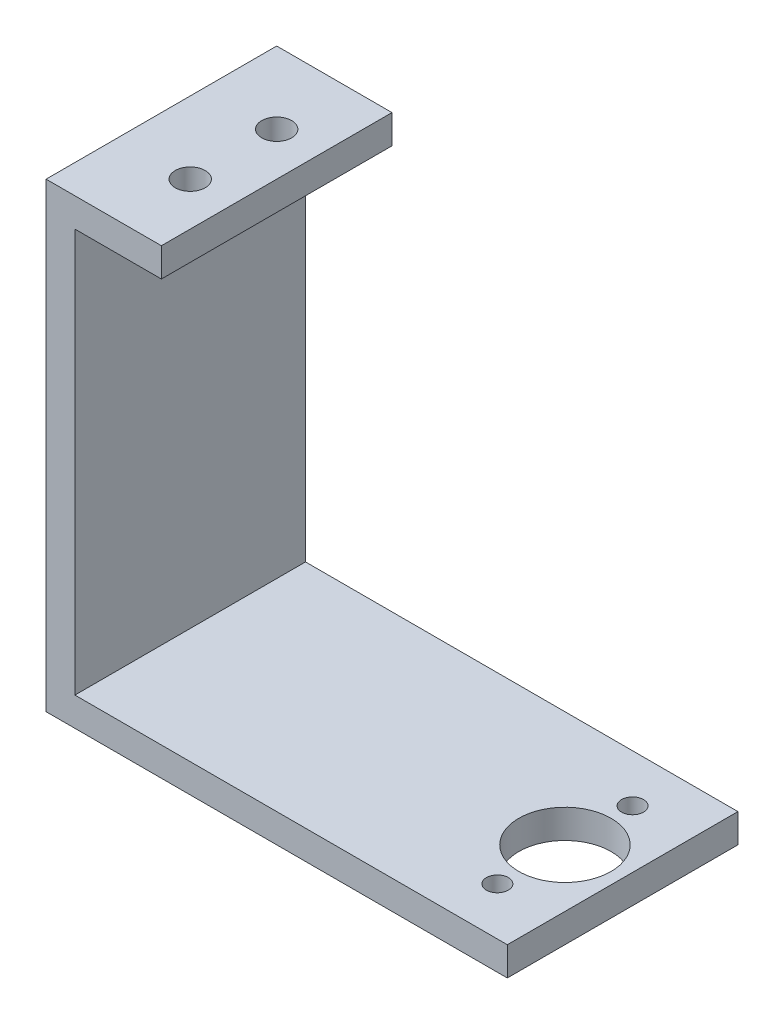
from build123d import *

# Parameters (mm, degrees)
BOSS_EXTRUDE1_DEPTH       = 25.4
M4X0_7_TAPPED_HOLE1_D     = 3.3
M4X0_7_TAPPED_HOLE1_DEPTH = 9.906
M4X0_7_TAPPED_HOLE1_TIP   = 0.991420021
CUT_EXTRUDE1_REACH        = 66.12
SKETCH7_R                 = 5.08
SKETCH7_R_2               = 1.2065


with BuildPart() as part:
    # Sketch1 → Boss-Extrude1 (new body)
    with BuildSketch(Plane.XY):
        Polygon((-17.059275079, 26.987213855), (-29.759275079, 26.987213855), (-29.759275079, -23.812786145), (21.040724921, -23.812786145), (21.040724921, -20.637786145), (-26.584275079, -20.637786145), (-26.584275079, 23.812213855), (-17.059275079, 23.812213855), align=None)
    extrude(amount=BOSS_EXTRUDE1_DEPTH)

    # M4x0.7 Tapped Hole1
    with Locations(Plane(origin=(0, 26.987213855, 0), x_dir=(1, 0, 0), z_dir=(0, 1, 0))):
        with Locations((-21.821775079, -7.9375), (-21.821775079, -17.4625)):
            Hole(M4X0_7_TAPPED_HOLE1_D / 2, depth=M4X0_7_TAPPED_HOLE1_DEPTH)
            with Locations((0, 0, -(M4X0_7_TAPPED_HOLE1_DEPTH + M4X0_7_TAPPED_HOLE1_TIP / 2))):  # 118° drill point
                Cone(0, M4X0_7_TAPPED_HOLE1_D / 2, M4X0_7_TAPPED_HOLE1_TIP, mode=Mode.SUBTRACT)

    # Sketch7 → Cut-Extrude1 (cut, up to next)
    with BuildSketch(Plane.XZ.offset(23.812786145), mode=Mode.PRIVATE) as cut_extrude1_sk1:
        with Locations((14.690724921, 12.7)):
            Circle(SKETCH7_R)
    cut_extrude1_tool1 = extrude(cut_extrude1_sk1.sketch, amount=-CUT_EXTRUDE1_REACH, mode=Mode.PRIVATE) & part.part
    # Sketch7 → Cut-Extrude1 (cut, up to next)
    with BuildSketch(Plane.XZ.offset(23.812786145), mode=Mode.PRIVATE) as cut_extrude1_sk2:
        with Locations((14.690724921, 5.2578)):
            Circle(SKETCH7_R_2)
    cut_extrude1_tool2 = extrude(cut_extrude1_sk2.sketch, amount=-CUT_EXTRUDE1_REACH, mode=Mode.PRIVATE) & part.part
    # Sketch7 → Cut-Extrude1 (cut, up to next)
    with BuildSketch(Plane.XZ.offset(23.812786145), mode=Mode.PRIVATE) as cut_extrude1_sk3:
        with Locations((14.690724921, 20.1422)):
            Circle(SKETCH7_R_2)
    cut_extrude1_tool3 = extrude(cut_extrude1_sk3.sketch, amount=-CUT_EXTRUDE1_REACH, mode=Mode.PRIVATE) & part.part
    add(cut_extrude1_tool1.solids().sort_by_distance((14.690725, -23.812786, 12.7))[0], mode=Mode.SUBTRACT)
    add(cut_extrude1_tool2.solids().sort_by_distance((14.690725, -23.812786, 5.2578))[0], mode=Mode.SUBTRACT)
    add(cut_extrude1_tool3.solids().sort_by_distance((14.690725, -23.812786, 20.1422))[0], mode=Mode.SUBTRACT)


solid = part.part
